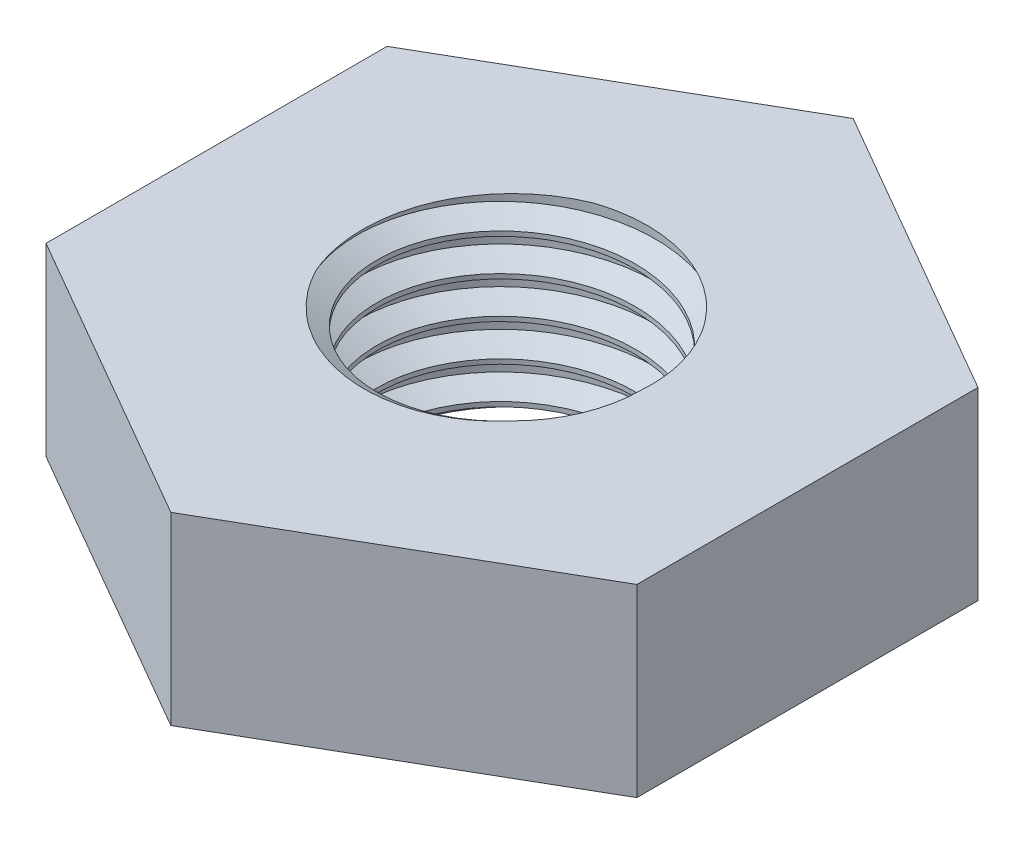
from build123d import *

# Parameters (mm, degrees)
BOSS_EXTRUDE1_DEPTH    = 5
M16X2_0_TAPPED_HOLE1_D = 14
THREAD1_PITCH          = 2


with BuildPart() as part:
    # Sketch1 → Boss-Extrude1 (new, symmetric)
    with BuildSketch(Plane(origin=(0, 0, 0), x_dir=(1, 0, 0), z_dir=(0, 1, 0))):
        Polygon((0, 18.475208614), (-16, 9.237604307), (-16, -9.237604307), (0, -18.475208614), (16, -9.237604307), (16, 9.237604307), align=None)
    extrude(amount=BOSS_EXTRUDE1_DEPTH, both=True)

    # M16x2.0 Tapped Hole1 (through all)
    with Locations(Plane(origin=(0, 5, 0), x_dir=(1, 0, 0), z_dir=(0, 1, 0))):
        with Locations((0, 0)):
            Hole(M16X2_0_TAPPED_HOLE1_D / 2)

    # Thread1: the profile of Thread Profile1 profile screwed along a right-hand helix of 19 turns, 10 arcs to a turn; built about Z, then put on its axis
    thread1_z = Axis((0, 0, 0), (0, 0, 1))
    thread1_corners = [(6.9997, 0, -0.000173205), (6.9997, 0, 1.7501732), (8.08253175, 0, 1.124999997), (8.08253175, 0, 0.624999997)]
    with BuildLine(mode=Mode.PRIVATE) as thread1_profile:
        Line(thread1_corners[0], thread1_corners[1])
        Line(thread1_corners[1], thread1_corners[2])
        Line(thread1_corners[2], thread1_corners[3])
        Line(thread1_corners[3], thread1_corners[0])
    thread1_cap = Face(thread1_profile.wire())
    thread1_turn_angles = [0, 18, 36, 54, 72, 90, 108, 126, 144, 162, 180, 198, 216, 234, 252, 270, 288, 306, 324, 342, 360]
    thread1_turn_weights = [1, 0.9510565162951535, 1, 0.9510565162951535, 1, 0.9510565162951535, 1, 0.9510565162951535, 1, 0.9510565162951535, 1, 0.9510565162951535, 1, 0.9510565162951535, 1, 0.9510565162951535, 1, 0.9510565162951535, 1, 0.9510565162951535, 1]
    thread1_turn_rails = [Edge.make_bspline([Vector(p[0], p[1], 0).rotate(thread1_z, thread1_turn_angles[k]) / thread1_turn_weights[k] + Vector(0, 0, p[2] + THREAD1_PITCH * thread1_turn_angles[k] / 360) for k in range(21)], [0, 0, 0, 1, 1, 2, 2, 3, 3, 4, 4, 5, 5, 6, 6, 7, 7, 8, 8, 9, 9, 10, 10, 10], 2, thread1_turn_weights) for p in thread1_corners]
    thread1_turn_sides = [Face.make_surface_from_curves(thread1_turn_rails[p[0]], thread1_turn_rails[p[1]]) for p in [(0, 1), (1, 2), (2, 3), (3, 0)]]
    thread1 = Plane(origin=(0, 8, 0), x_dir=(-1, 0, 0), z_dir=(0, -1, 0)) * Solid(Shell([*[p.moved(Location((0, 0, THREAD1_PITCH * i))) for i in range(19) for p in thread1_turn_sides], thread1_cap, thread1_cap.rotate(thread1_z, 6840).moved(Location((0, 0, THREAD1_PITCH * 6840 / 360)))]))
    add(thread1, mode=Mode.SUBTRACT)


solid = part.part
